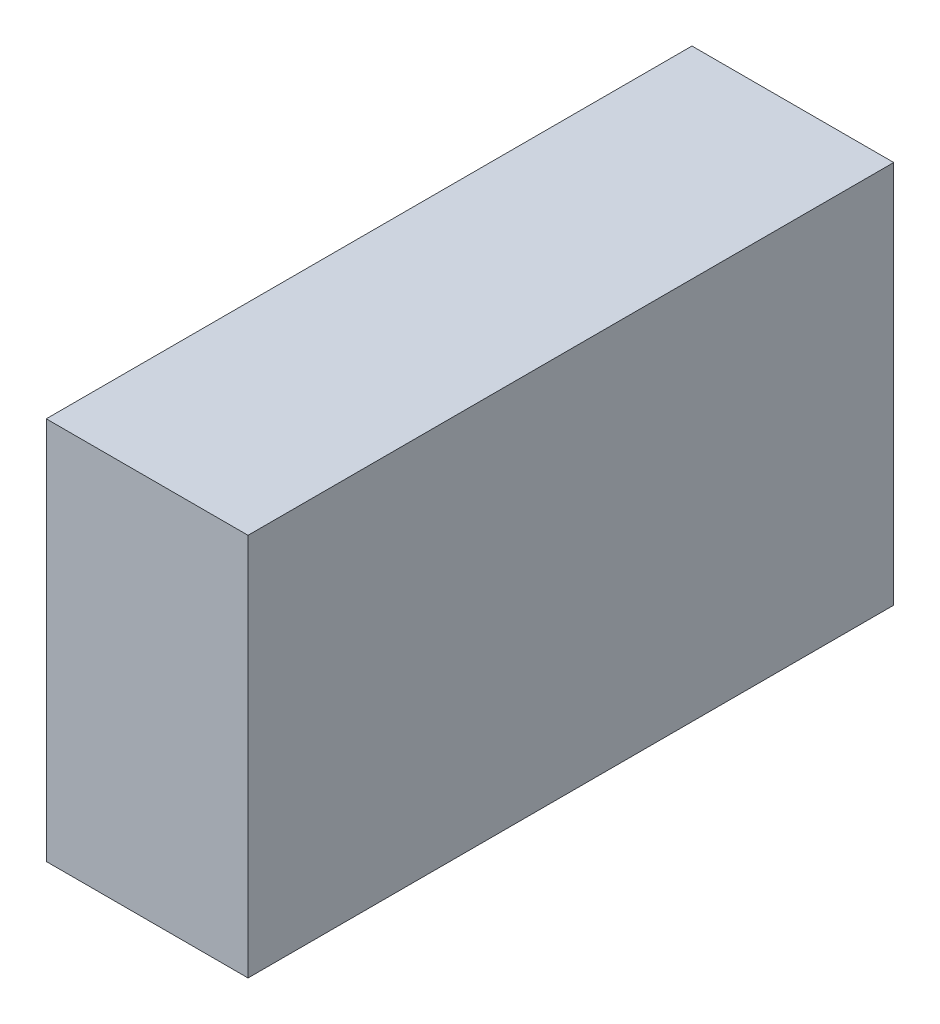
from build123d import *

# Parameters (mm, degrees)
SKETCH_1_W      = 50
SKETCH_1_H      = 95
EXTRUDE_1_DEPTH = 160


with BuildPart() as part:
    # 草图1 → 凸台-拉伸1 (new body)
    with BuildSketch(Plane.XY):
        Rectangle(SKETCH_1_W, SKETCH_1_H)
    extrude(amount=EXTRUDE_1_DEPTH)


solid = part.part
